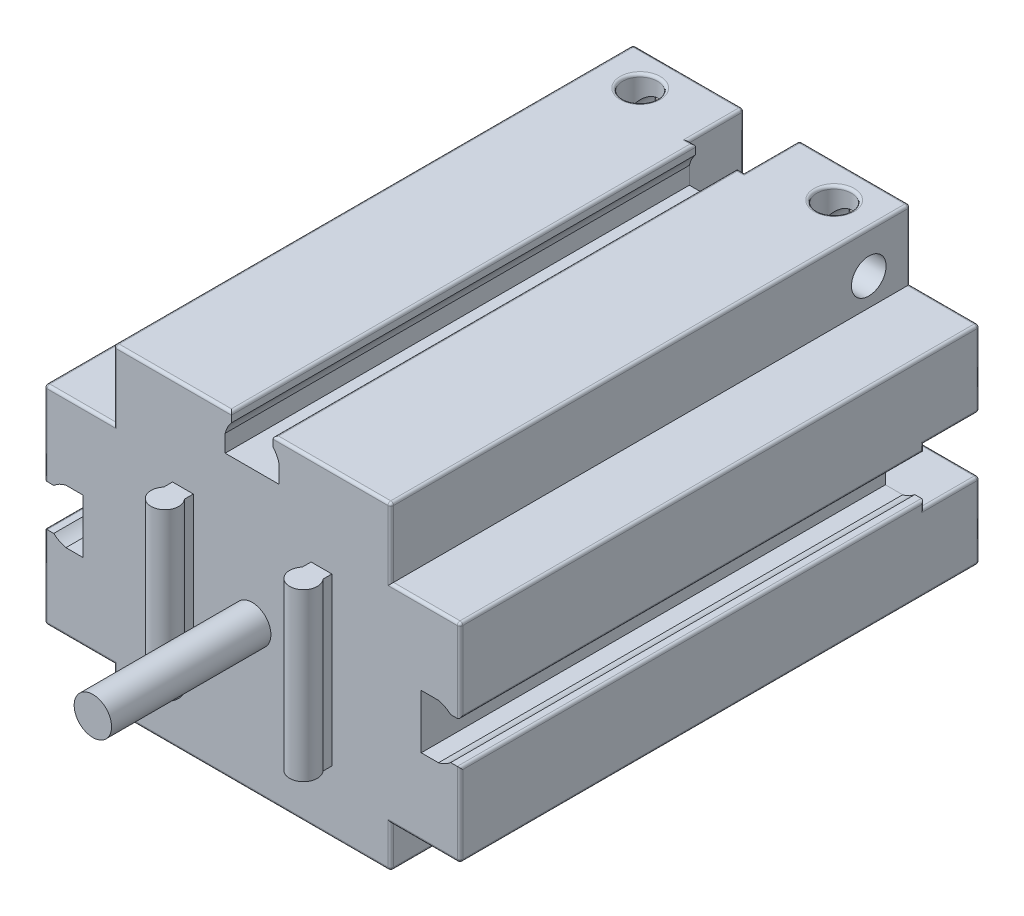
from build123d import *

# Parameters (mm, degrees)
EXTRUDE_1_DEPTH     = 37.5
SKETCH_3_W          = 4
SKETCH_3_H          = 4
CUT_EXTRUDE_1_DEPTH = 4
CUT_EXTRUDE_2_DEPTH = 47.478489648
CUT_EXTRUDE_3_REACH = 53.1
SKETCH_6_R          = 1.35
EXTRUDE_2_DEPTH     = 11.5
EXTRUDE_START       = 4.5
EXTRUDE_3_DEPTH     = 12
SKETCH_8_R          = 1.25
CUT_EXTRUDE_4_DEPTH = 5
SKETCH_9_R          = 1.25
CUT_EXTRUDE_5_DEPTH = 5
SKETCH_10_R         = 1.25
CUT_EXTRUDE_6_DEPTH = 5
CUT_EXTRUDE_START   = -5
SKETCH_11_R         = 1.25
CUT_EXTRUDE_7_DEPTH = 5
FILLET_1_R          = 0.2
FILLET_2_R          = 0.2
FILLET_3_R          = 0.2


with BuildPart() as part:
    # 草图1 → 凸台-拉伸1 (new body)
    with BuildSketch(Plane.XY):
        Polygon((-15, 3), (-10, 3), (-10, 0), (10, 0), (10, 3), (15, 3), (15, 18), (10, 18), (10, 23), (-10, 23), (-10, 18), (-15, 18), align=None)
    extrude(amount=-EXTRUDE_1_DEPTH)

    # 草图3 → 切除-拉伸1 (cut)
    with BuildSketch(Plane(origin=(0, 0, -37.5), x_dir=(-1, 0, 0), z_dir=(0, 0, -1))):
        with Locations((-13, 10.5)):
            Rectangle(SKETCH_3_W, SKETCH_3_H)
        with Locations((13, 10.5)):
            Rectangle(SKETCH_3_W, SKETCH_3_H)
        with Locations((0, 21)):
            Rectangle(SKETCH_3_W, SKETCH_3_H)
    extrude(amount=-CUT_EXTRUDE_1_DEPTH, mode=Mode.SUBTRACT)

    # 草图4 → 切除-拉伸2 (cut, through all)
    with BuildSketch(Plane.XY):
        with BuildLine():
            Line((-1.5, 23), (-1.5, 22.322875656))
            ThreePointArc((-1.5, 22.322875656), (-1.780042303, 21.911838473), (-1.95, 21.444409721))
            Line((-1.95, 21.444409721), (-1.95, 20.2))
            Line((-1.95, 20.2), (1.95, 20.2))
            Line((1.95, 20.2), (1.95, 21.444409721))
            ThreePointArc((1.95, 21.444409721), (1.780042303, 21.911838473), (1.5, 22.322875656))
            Line((1.5, 22.322875656), (1.5, 23))
            Line((1.5, 23), (-1.5, 23))
        make_face()
        with BuildLine():
            Line((-15, 9), (-14.322875656, 9))
            ThreePointArc((-14.322875656, 9), (-13.911838473, 8.719957697), (-13.444409721, 8.55))
            Line((-13.444409721, 8.55), (-12.2, 8.55))
            Line((-12.2, 8.55), (-12.2, 12.45))
            Line((-12.2, 12.45), (-13.444409721, 12.45))
            ThreePointArc((-13.444409721, 12.45), (-13.911838473, 12.280042303), (-14.322875656, 12))
            Line((-14.322875656, 12), (-15, 12))
            Line((-15, 12), (-15, 9))
        make_face()
        with BuildLine():
            Line((12.2, 8.55), (12.2, 12.45))
            Line((12.2, 12.45), (13.444409721, 12.45))
            ThreePointArc((13.444409721, 12.45), (13.911838473, 12.280042303), (14.322875656, 12))
            Line((14.322875656, 12), (15, 12))
            Line((15, 12), (15, 9))
            Line((15, 9), (14.322875656, 9))
            ThreePointArc((14.322875656, 9), (13.911838473, 8.719957697), (13.444409721, 8.55))
            Line((13.444409721, 8.55), (12.2, 8.55))
        make_face()
    extrude(amount=-CUT_EXTRUDE_2_DEPTH, mode=Mode.SUBTRACT)

    # 草图5 → 切除-拉伸3 (cut, up to next)
    with BuildSketch(Plane(origin=(11, 0, 0), x_dir=(0, 0, -1), z_dir=(1, 0, 0)), mode=Mode.PRIVATE) as cut_extrude_3_sk1:
        with BuildLine():
            Line((37.5, 12), (36.822875656, 12))
            ThreePointArc((36.822875656, 12), (36.411838473, 12.280042303), (35.944409721, 12.45))
            Line((35.944409721, 12.45), (34.7, 12.45))
            Line((34.7, 12.45), (34.7, 8.55))
            Line((34.7, 8.55), (35.944409721, 8.55))
            ThreePointArc((35.944409721, 8.55), (36.411838473, 8.719957697), (36.822875656, 9))
            Line((36.822875656, 9), (37.5, 9))
            Line((37.5, 9), (37.5, 12))
        make_face()
    cut_extrude_3_tool1 = extrude(cut_extrude_3_sk1.sketch, amount=-CUT_EXTRUDE_3_REACH, mode=Mode.PRIVATE) & part.part
    add(cut_extrude_3_tool1.solids().sort_by_distance((11, 10.5, -36.020698))[0], mode=Mode.SUBTRACT)

    # 草图6 → 凸台-拉伸2 (add)
    with BuildSketch(Plane.XY):
        with Locations(Location((0, 10.5, 0), (0, 0, 180))):
            Circle(SKETCH_6_R)
    extrude(amount=EXTRUDE_2_DEPTH)

    # 草图7 → 凸台-拉伸3 (add)
    with BuildSketch(Plane(origin=(0, 0, 0), x_dir=(1, 0, 0), z_dir=(0, 1, 0)).offset(EXTRUDE_START)):
        with BuildLine():
            Line((-5.75, -0.638562172), (-5.75, 0))
            Line((-5.75, 0), (-4.25, 0))
            Line((-4.25, 0), (-4.25, -0.638562172))
            ThreePointArc((-4.25, -0.638562172), (-5, -2.3), (-5.75, -0.638562172))
        make_face()
        with BuildLine():
            Line((4.25, 0), (5.75, 0))
            Line((5.75, 0), (5.75, -0.638562172))
            ThreePointArc((5.75, -0.638562172), (5, -2.3), (4.25, -0.638562172))
            Line((4.25, -0.638562172), (4.25, 0))
        make_face()
    extrude(amount=EXTRUDE_3_DEPTH)

    # 草图8 → 切除-拉伸4 (cut)
    with BuildSketch(Plane(origin=(0, 23, 0), x_dir=(-1, 0, 0), z_dir=(0, 1, 0))):
        with Locations(Location((7, -35, 0), (0, 0, 90))):
            Circle(SKETCH_8_R)
        with Locations(Location((-7, -35, 0), (0, 0, 90))):
            Circle(SKETCH_8_R)
    extrude(amount=-CUT_EXTRUDE_4_DEPTH, mode=Mode.SUBTRACT)

    # 草图9 → 切除-拉伸5 (cut)
    with BuildSketch(Plane(origin=(0, 0, -37.5), x_dir=(-1, 0, 0), z_dir=(0, 0, -1))):
        with Locations((-7, 20.5)):
            Circle(SKETCH_9_R)
        with Locations((7, 20.5)):
            Circle(SKETCH_9_R)
    extrude(amount=-CUT_EXTRUDE_5_DEPTH, mode=Mode.SUBTRACT)

    # 草图10 → 切除-拉伸6 (cut)
    with BuildSketch(Plane.ZY.offset(10)):
        with Locations((-34.5, 20)):
            Circle(SKETCH_10_R)
    extrude(amount=-CUT_EXTRUDE_6_DEPTH, mode=Mode.SUBTRACT)

    # 草图11 → 切除-拉伸7 (cut)
    with BuildSketch(Plane(origin=(10, 0, 0), x_dir=(0, 0, -1), z_dir=(1, 0, 0)).offset(CUT_EXTRUDE_START)):
        with Locations(Location((34.5, 20, 0), (0, 0, 180))):
            Circle(SKETCH_11_R)
    extrude(amount=CUT_EXTRUDE_7_DEPTH, mode=Mode.SUBTRACT)

    # 圆角1
    fillet_1_edges = [part.edges().sort_by_distance(p)[0] for p in [
        (-15, 15.25, -37.5),
        (5.75, 23, 0),
        (-15, 12.25, -33.5),
        (-15, 6, 0),
        (15, 6, 0),
        (-15, 9, -16.75),
        (-15, 12, -16.75),
        (0, 0, 0),
        (15, 8.75, -33.5),
        (-15, 15, 0),
        (15, 15, 0),
        (15, 12, -16.75),
        (15, 9, -16.75),
        (0, 0, -37.5),
        (-10, 23, -18.75),
        (10, 23, -18.75),
        (15, 18, -18.75),
        (15, 3, -18.75),
        (10, 0, -18.75),
        (-10, 0, -18.75),
        (-15, 3, -18.75),
        (-15, 18, -18.75),
        (-7, 23, -36.25),
        (7, 23, -36.25),
        (15, 5.75, -37.5),
        (15, 15.25, -37.5),
        (6, 23, -37.5),
        (15, 12.25, -33.5),
        (15, 8.5, -35.5),
        (15, 12.5, -35.5),
        (-15, 5.75, -37.5),
        (-15, 8.75, -33.5),
        (-15, 12.5, -35.5),
        (-15, 8.5, -35.5),
        (-6, 23, -37.5),
        (-1.75, 23, -33.5),
        (2, 23, -35.5),
        (-2, 23, -35.5),
        (1.75, 23, -33.5),
        (-5.75, 23, 0),
        (-1.5, 23, -16.75),
        (1.5, 23, -16.75),
    ]]
    fillet(fillet_1_edges, radius=FILLET_1_R)

    # 圆角2
    # the kernel refuses this fillet: 0.2 mm, written as the material it takes off along each edge
    with BuildSketch(Plane(origin=(14.8, 17.8, -37.3), x_dir=(0, 0, -1), z_dir=(0, 1, 0))) as fillet_2_piece_1_section:
        Polygon((0, 0), (FILLET_2_R, 0), (FILLET_2_R, -FILLET_2_R), (0, -FILLET_2_R), align=None)
    fillet_2_piece_1 = extrude(amount=FILLET_2_R, mode=Mode.PRIVATE)
    fillet_2_piece_1 = fillet_2_piece_1 - Plane(origin=(14.8, 17.8, -37.3), x_dir=(-0.7071067811865475, 0, 0.7071067811865475), z_dir=(0, 1, 0)) * Sphere(FILLET_2_R, mode=Mode.PRIVATE)
    add(fillet_2_piece_1, mode=Mode.SUBTRACT)
    with BuildSketch(Plane(origin=(14.8, 17.8, -0.2), x_dir=(0, 1, 0), z_dir=(0, 0, 1))) as fillet_2_piece_2_section:
        Polygon((0, 0), (FILLET_2_R, 0), (FILLET_2_R, -FILLET_2_R), (0, -FILLET_2_R), align=None)
    fillet_2_piece_2 = extrude(amount=FILLET_2_R, mode=Mode.PRIVATE)
    fillet_2_piece_2 = fillet_2_piece_2 - Plane(origin=(14.8, 17.8, -0.2), x_dir=(-0.7071067811865475, -0.7071067811865475, 0), z_dir=(0, 0, 1)) * Sphere(FILLET_2_R, mode=Mode.PRIVATE)
    add(fillet_2_piece_2, mode=Mode.SUBTRACT)
    with BuildSketch(Plane(origin=(14.8, 3.2, -0.2), x_dir=(0, -1, 0), z_dir=(0, 0, 1))) as fillet_2_piece_3_section:
        Polygon((0, 0), (FILLET_2_R, 0), (FILLET_2_R, FILLET_2_R), (0, FILLET_2_R), align=None)
    fillet_2_piece_3 = extrude(amount=FILLET_2_R, mode=Mode.PRIVATE)
    fillet_2_piece_3 = fillet_2_piece_3 - Plane(origin=(14.8, 3.2, -0.2), x_dir=(-0.7071067811865475, 0.7071067811865475, 0), z_dir=(0, 0, 1)) * Sphere(FILLET_2_R, mode=Mode.PRIVATE)
    add(fillet_2_piece_3, mode=Mode.SUBTRACT)
    with BuildSketch(Plane(origin=(14.8, 3.2, -37.3), x_dir=(0, -1, 0), z_dir=(0, 0, -1))) as fillet_2_piece_4_section:
        Polygon((0, 0), (FILLET_2_R, 0), (FILLET_2_R, -FILLET_2_R), (0, -FILLET_2_R), align=None)
    fillet_2_piece_4 = extrude(amount=FILLET_2_R, mode=Mode.PRIVATE)
    fillet_2_piece_4 = fillet_2_piece_4 - Plane(origin=(14.8, 3.2, -37.3), x_dir=(-0.7071067811865475, 0.7071067811865475, 0), z_dir=(0, 0, -1)) * Sphere(FILLET_2_R, mode=Mode.PRIVATE)
    add(fillet_2_piece_4, mode=Mode.SUBTRACT)
    with BuildSketch(Plane(origin=(-9.8, 0.2, -37.3), x_dir=(0, 0, -1), z_dir=(-1, 0, 0))) as fillet_2_piece_5_section:
        Polygon((0, 0), (FILLET_2_R, 0), (FILLET_2_R, FILLET_2_R), (0, FILLET_2_R), align=None)
    fillet_2_piece_5 = extrude(amount=FILLET_2_R, mode=Mode.PRIVATE)
    fillet_2_piece_5 = fillet_2_piece_5 - Plane(origin=(-9.8, 0.2, -37.3), x_dir=(0, 0.7071067811865475, 0.7071067811865475), z_dir=(-1, 0, 0)) * Sphere(FILLET_2_R, mode=Mode.PRIVATE)
    add(fillet_2_piece_5, mode=Mode.SUBTRACT)
    with BuildSketch(Plane(origin=(-9.8, 0.2, -0.2), x_dir=(-1, 0, 0), z_dir=(0, 0, 1))) as fillet_2_piece_6_section:
        Polygon((0, 0), (FILLET_2_R, 0), (FILLET_2_R, FILLET_2_R), (0, FILLET_2_R), align=None)
    fillet_2_piece_6 = extrude(amount=FILLET_2_R, mode=Mode.PRIVATE)
    fillet_2_piece_6 = fillet_2_piece_6 - Plane(origin=(-9.8, 0.2, -0.2), x_dir=(0.7071067811865475, 0.7071067811865475, 0), z_dir=(0, 0, 1)) * Sphere(FILLET_2_R, mode=Mode.PRIVATE)
    add(fillet_2_piece_6, mode=Mode.SUBTRACT)
    with BuildSketch(Plane(origin=(9.8, 0.2, -37.3), x_dir=(1, 0, 0), z_dir=(0, 0, -1))) as fillet_2_piece_7_section:
        Polygon((0, 0), (FILLET_2_R, 0), (FILLET_2_R, FILLET_2_R), (0, FILLET_2_R), align=None)
    fillet_2_piece_7 = extrude(amount=FILLET_2_R, mode=Mode.PRIVATE)
    fillet_2_piece_7 = fillet_2_piece_7 - Plane(origin=(9.8, 0.2, -37.3), x_dir=(-0.7071067811865477, 0.7071067811865474, 0), z_dir=(0, 0, -1)) * Sphere(FILLET_2_R, mode=Mode.PRIVATE)
    add(fillet_2_piece_7, mode=Mode.SUBTRACT)
    with BuildSketch(Plane(origin=(9.8, 0.2, -0.2), x_dir=(1, 0, 0), z_dir=(0, 0, 1))) as fillet_2_piece_8_section:
        Polygon((0, 0), (FILLET_2_R, 0), (FILLET_2_R, -FILLET_2_R), (0, -FILLET_2_R), align=None)
    fillet_2_piece_8 = extrude(amount=FILLET_2_R, mode=Mode.PRIVATE)
    fillet_2_piece_8 = fillet_2_piece_8 - Plane(origin=(9.8, 0.2, -0.2), x_dir=(-0.7071067811865477, 0.7071067811865474, 0), z_dir=(0, 0, 1)) * Sphere(FILLET_2_R, mode=Mode.PRIVATE)
    add(fillet_2_piece_8, mode=Mode.SUBTRACT)
    with BuildSketch(Plane(origin=(-14.8, 3.2, -37.3), x_dir=(0, 0, -1), z_dir=(0, -1, 0))) as fillet_2_piece_9_section:
        Polygon((0, 0), (FILLET_2_R, 0), (FILLET_2_R, -FILLET_2_R), (0, -FILLET_2_R), align=None)
    fillet_2_piece_9 = extrude(amount=FILLET_2_R, mode=Mode.PRIVATE)
    fillet_2_piece_9 = fillet_2_piece_9 - Plane(origin=(-14.8, 3.2, -37.3), x_dir=(0.7071067811865475, 0, 0.7071067811865475), z_dir=(0, -1, 0)) * Sphere(FILLET_2_R, mode=Mode.PRIVATE)
    add(fillet_2_piece_9, mode=Mode.SUBTRACT)
    with BuildSketch(Plane(origin=(-14.8, 3.2, -0.2), x_dir=(0, 0, 1), z_dir=(0, -1, 0))) as fillet_2_piece_10_section:
        Polygon((0, 0), (FILLET_2_R, 0), (FILLET_2_R, FILLET_2_R), (0, FILLET_2_R), align=None)
    fillet_2_piece_10 = extrude(amount=FILLET_2_R, mode=Mode.PRIVATE)
    fillet_2_piece_10 = fillet_2_piece_10 - Plane(origin=(-14.8, 3.2, -0.2), x_dir=(0.7071067811865475, 0, -0.7071067811865475), z_dir=(0, -1, 0)) * Sphere(FILLET_2_R, mode=Mode.PRIVATE)
    add(fillet_2_piece_10, mode=Mode.SUBTRACT)
    with BuildSketch(Plane(origin=(-14.8, 17.8, -0.2), x_dir=(0, 1, 0), z_dir=(0, 0, 1))) as fillet_2_piece_11_section:
        Polygon((0, 0), (FILLET_2_R, 0), (FILLET_2_R, FILLET_2_R), (0, FILLET_2_R), align=None)
    fillet_2_piece_11 = extrude(amount=FILLET_2_R, mode=Mode.PRIVATE)
    fillet_2_piece_11 = fillet_2_piece_11 - Plane(origin=(-14.8, 17.8, -0.2), x_dir=(0.7071067811865475, -0.7071067811865475, 0), z_dir=(0, 0, 1)) * Sphere(FILLET_2_R, mode=Mode.PRIVATE)
    add(fillet_2_piece_11, mode=Mode.SUBTRACT)
    with BuildSketch(Plane(origin=(-14.8, 17.8, -37.3), x_dir=(0, 0, -1), z_dir=(0, 1, 0))) as fillet_2_piece_12_section:
        Polygon((0, 0), (FILLET_2_R, 0), (FILLET_2_R, FILLET_2_R), (0, FILLET_2_R), align=None)
    fillet_2_piece_12 = extrude(amount=FILLET_2_R, mode=Mode.PRIVATE)
    fillet_2_piece_12 = fillet_2_piece_12 - Plane(origin=(-14.8, 17.8, -37.3), x_dir=(0.7071067811865475, 0, 0.7071067811865475), z_dir=(0, 1, 0)) * Sphere(FILLET_2_R, mode=Mode.PRIVATE)
    add(fillet_2_piece_12, mode=Mode.SUBTRACT)
    with BuildSketch(Plane(origin=(-9.8, 22.8, -37.3), x_dir=(0, 0, -1), z_dir=(-1, 0, 0))) as fillet_2_piece_13_section:
        Polygon((0, 0), (FILLET_2_R, 0), (FILLET_2_R, -FILLET_2_R), (0, -FILLET_2_R), align=None)
    fillet_2_piece_13 = extrude(amount=FILLET_2_R, mode=Mode.PRIVATE)
    fillet_2_piece_13 = fillet_2_piece_13 - Plane(origin=(-9.8, 22.8, -37.3), x_dir=(0, -0.7071067811865475, 0.7071067811865475), z_dir=(-1, 0, 0)) * Sphere(FILLET_2_R, mode=Mode.PRIVATE)
    add(fillet_2_piece_13, mode=Mode.SUBTRACT)
    with BuildSketch(Plane(origin=(-9.8, 22.8, -0.2), x_dir=(-1, 0, 0), z_dir=(0, 0, 1))) as fillet_2_piece_14_section:
        Polygon((0, 0), (FILLET_2_R, 0), (FILLET_2_R, -FILLET_2_R), (0, -FILLET_2_R), align=None)
    fillet_2_piece_14 = extrude(amount=FILLET_2_R, mode=Mode.PRIVATE)
    fillet_2_piece_14 = fillet_2_piece_14 - Plane(origin=(-9.8, 22.8, -0.2), x_dir=(0.7071067811865475, -0.7071067811865475, 0), z_dir=(0, 0, 1)) * Sphere(FILLET_2_R, mode=Mode.PRIVATE)
    add(fillet_2_piece_14, mode=Mode.SUBTRACT)
    with BuildSketch(Plane(origin=(9.8, 22.8, -0.2), x_dir=(1, 0, 0), z_dir=(0, 0, 1))) as fillet_2_piece_15_section:
        Polygon((0, 0), (FILLET_2_R, 0), (FILLET_2_R, FILLET_2_R), (0, FILLET_2_R), align=None)
    fillet_2_piece_15 = extrude(amount=FILLET_2_R, mode=Mode.PRIVATE)
    fillet_2_piece_15 = fillet_2_piece_15 - Plane(origin=(9.8, 22.8, -0.2), x_dir=(-0.7071067811865476, -0.7071067811865474, 0), z_dir=(0, 0, 1)) * Sphere(FILLET_2_R, mode=Mode.PRIVATE)
    add(fillet_2_piece_15, mode=Mode.SUBTRACT)
    with BuildSketch(Plane(origin=(9.8, 22.8, -37.3), x_dir=(0, 0, -1), z_dir=(1, 0, 0))) as fillet_2_piece_16_section:
        Polygon((0, 0), (FILLET_2_R, 0), (FILLET_2_R, FILLET_2_R), (0, FILLET_2_R), align=None)
    fillet_2_piece_16 = extrude(amount=FILLET_2_R, mode=Mode.PRIVATE)
    fillet_2_piece_16 = fillet_2_piece_16 - Plane(origin=(9.8, 22.8, -37.3), x_dir=(0, -0.7071067811865475, 0.7071067811865475), z_dir=(1, 0, 0)) * Sphere(FILLET_2_R, mode=Mode.PRIVATE)
    add(fillet_2_piece_16, mode=Mode.SUBTRACT)
    with BuildSketch(Plane(origin=(10, 18, 0), x_dir=(-1, 0, 0), z_dir=(0, 1, 0)), Plane(origin=(10, 3, 0), x_dir=(0, 1, 0), z_dir=(1, 0, 0)), Plane(origin=(-10, 18, 0), x_dir=(0, -1, 0), z_dir=(-1, 0, 0)), Plane(origin=(14.8, 18, 0), x_dir=(0, -1, 0), z_dir=(-1, 0, 0)), Plane(origin=(-10, 22.8, 0), x_dir=(1, 0, 0), z_dir=(0, -1, 0)), Plane(origin=(14.8, 18, -37.5), x_dir=(0, 0, 1), z_dir=(-1, 0, 0)), Plane(origin=(-10, 22.8, -37.5), x_dir=(0, 0, 1), z_dir=(0, -1, 0)), Plane(origin=(-14.8, 3, -37.5), x_dir=(0, 0, 1), z_dir=(1, 0, 0)), Plane(origin=(10, 18, -37.5), x_dir=(0, 0, 1), z_dir=(0, 1, 0)), Plane(origin=(-10, 18, -37.5), x_dir=(0, 0, 1), z_dir=(-1, 0, 0))) as fillet_2_piece_17:
        with BuildLine():
            CenterArc((FILLET_2_R, -FILLET_2_R), FILLET_2_R, 90, 90)
            Line((0, -FILLET_2_R), (0, 0))
            Line((0, 0), (FILLET_2_R, 0))
        make_face()
    extrude(amount=4.8, mode=Mode.SUBTRACT)
    with BuildSketch(Plane(origin=(-10, 3, 0), x_dir=(1, 0, 0), z_dir=(0, -1, 0)), Plane(origin=(-10, 3, -37.5), x_dir=(0, 0, 1), z_dir=(0, -1, 0)), Plane(origin=(10, 0.2, 0), x_dir=(-1, 0, 0), z_dir=(0, 1, 0))) as fillet_2_piece_18:
        with BuildLine():
            CenterArc((FILLET_2_R, -FILLET_2_R), FILLET_2_R, 90, 90)
            Line((0, -FILLET_2_R), (0, 0))
            Line((0, 0), (FILLET_2_R, 0))
        make_face()
    extrude(amount=2.8, mode=Mode.SUBTRACT)
    with BuildSketch(Plane(origin=(10, 3, -37.5), x_dir=(0, 1, 0), z_dir=(1, 0, 0)), Plane(origin=(-14.8, 3, 0), x_dir=(0, 0, -1), z_dir=(1, 0, 0))) as fillet_2_piece_19:
        with BuildLine():
            CenterArc((FILLET_2_R, FILLET_2_R), FILLET_2_R, 180, 90)
            Line((0, FILLET_2_R), (0, 0))
            Line((0, 0), (FILLET_2_R, 0))
        make_face()
    extrude(amount=4.8, mode=Mode.SUBTRACT)
    with BuildSketch(Plane(origin=(10, 0.2, -37.5), x_dir=(-1, 0, 0), z_dir=(0, 1, 0))) as fillet_2_piece_20:
        with BuildLine():
            CenterArc((FILLET_2_R, FILLET_2_R), FILLET_2_R, 180, 90)
            Line((0, FILLET_2_R), (0, 0))
            Line((0, 0), (FILLET_2_R, 0))
        make_face()
    extrude(amount=2.8, mode=Mode.SUBTRACT)
    with BuildSketch(Plane(origin=(14.8, 18, 0), x_dir=(0, -1, 0), z_dir=(-1, 0, 0))) as fillet_2_piece_21a_section:
        with BuildLine():
            CenterArc((FILLET_2_R, -FILLET_2_R), FILLET_2_R, 90, 90)
            Line((0, -FILLET_2_R), (0, 0))
            Line((0, 0), (FILLET_2_R, 0))
        make_face()
    fillet_2_piece_21a = extrude(amount=5.3, mode=Mode.PRIVATE)
    fillet_2_piece_21a = split(fillet_2_piece_21a, bisect_by=Plane(origin=(10, 17.954720977, -0.045279023), z_dir=(-1, 0, 0)), keep=Keep.TOP, mode=Mode.PRIVATE)
    with BuildSketch(Plane(origin=(10, 17.5, 0), x_dir=(-1, 0, 0), z_dir=(0, 1, 0))) as fillet_2_piece_21b_section:
        with BuildLine():
            CenterArc((FILLET_2_R, -FILLET_2_R), FILLET_2_R, 90, 90)
            Line((0, -FILLET_2_R), (0, 0))
            Line((0, 0), (FILLET_2_R, 0))
        make_face()
    fillet_2_piece_21b = extrude(amount=5.3, mode=Mode.PRIVATE)
    fillet_2_piece_21b = split(fillet_2_piece_21b, bisect_by=Plane(origin=(9.954720977, 18, -0.045279023), z_dir=(0, -1, 0)), keep=Keep.TOP, mode=Mode.PRIVATE)
    fillet_2_piece_21 = fillet_2_piece_21a & fillet_2_piece_21b
    add(fillet_2_piece_21, mode=Mode.SUBTRACT)
    with BuildSketch(Plane(origin=(10, 0.2, 0), x_dir=(-1, 0, 0), z_dir=(0, 1, 0))) as fillet_2_piece_22a_section:
        with BuildLine():
            CenterArc((FILLET_2_R, -FILLET_2_R), FILLET_2_R, 90, 90)
            Line((0, -FILLET_2_R), (0, 0))
            Line((0, 0), (FILLET_2_R, 0))
        make_face()
    fillet_2_piece_22a = extrude(amount=3.3, mode=Mode.PRIVATE)
    fillet_2_piece_22a = split(fillet_2_piece_22a, bisect_by=Plane(origin=(9.954720977, 3, -0.045279023), z_dir=(0, 1, 0)), keep=Keep.TOP, mode=Mode.PRIVATE)
    with BuildSketch(Plane(origin=(9.5, 3, 0), x_dir=(0, 1, 0), z_dir=(1, 0, 0))) as fillet_2_piece_22b_section:
        with BuildLine():
            CenterArc((FILLET_2_R, -FILLET_2_R), FILLET_2_R, 90, 90)
            Line((0, -FILLET_2_R), (0, 0))
            Line((0, 0), (FILLET_2_R, 0))
        make_face()
    fillet_2_piece_22b = extrude(amount=5.3, mode=Mode.PRIVATE)
    fillet_2_piece_22b = split(fillet_2_piece_22b, bisect_by=Plane(origin=(10, 3.045279023, -0.045279023), z_dir=(-1, 0, 0)), keep=Keep.TOP, mode=Mode.PRIVATE)
    fillet_2_piece_22 = fillet_2_piece_22a & fillet_2_piece_22b
    add(fillet_2_piece_22, mode=Mode.SUBTRACT)
    with BuildSketch(Plane(origin=(-14.8, 3, 0), x_dir=(0, 0, -1), z_dir=(1, 0, 0))) as fillet_2_piece_23a_section:
        with BuildLine():
            CenterArc((FILLET_2_R, FILLET_2_R), FILLET_2_R, 180, 90)
            Line((0, FILLET_2_R), (0, 0))
            Line((0, 0), (FILLET_2_R, 0))
        make_face()
    fillet_2_piece_23a = extrude(amount=5.3, mode=Mode.PRIVATE)
    fillet_2_piece_23a = split(fillet_2_piece_23a, bisect_by=Plane(origin=(-10, 3.045279023, -0.045279023), z_dir=(1, 0, 0)), keep=Keep.TOP, mode=Mode.PRIVATE)
    with BuildSketch(Plane(origin=(-10, 3.5, 0), x_dir=(1, 0, 0), z_dir=(0, -1, 0))) as fillet_2_piece_23b_section:
        with BuildLine():
            CenterArc((FILLET_2_R, -FILLET_2_R), FILLET_2_R, 90, 90)
            Line((0, -FILLET_2_R), (0, 0))
            Line((0, 0), (FILLET_2_R, 0))
        make_face()
    fillet_2_piece_23b = extrude(amount=3.3, mode=Mode.PRIVATE)
    fillet_2_piece_23b = split(fillet_2_piece_23b, bisect_by=Plane(origin=(-9.954720977, 3, -0.045279023), z_dir=(0, 1, 0)), keep=Keep.TOP, mode=Mode.PRIVATE)
    fillet_2_piece_23 = fillet_2_piece_23a & fillet_2_piece_23b
    add(fillet_2_piece_23, mode=Mode.SUBTRACT)
    with BuildSketch(Plane(origin=(-9.5, 18, 0), x_dir=(0, -1, 0), z_dir=(-1, 0, 0))) as fillet_2_piece_24a_section:
        with BuildLine():
            CenterArc((FILLET_2_R, -FILLET_2_R), FILLET_2_R, 90, 90)
            Line((0, -FILLET_2_R), (0, 0))
            Line((0, 0), (FILLET_2_R, 0))
        make_face()
    fillet_2_piece_24a = extrude(amount=5.3, mode=Mode.PRIVATE)
    fillet_2_piece_24a = split(fillet_2_piece_24a, bisect_by=Plane(origin=(-10, 17.954720977, -0.045279023), z_dir=(1, 0, 0)), keep=Keep.TOP, mode=Mode.PRIVATE)
    with BuildSketch(Plane(origin=(-10, 22.8, 0), x_dir=(1, 0, 0), z_dir=(0, -1, 0))) as fillet_2_piece_24b_section:
        with BuildLine():
            CenterArc((FILLET_2_R, -FILLET_2_R), FILLET_2_R, 90, 90)
            Line((0, -FILLET_2_R), (0, 0))
            Line((0, 0), (FILLET_2_R, 0))
        make_face()
    fillet_2_piece_24b = extrude(amount=5.3, mode=Mode.PRIVATE)
    fillet_2_piece_24b = split(fillet_2_piece_24b, bisect_by=Plane(origin=(-9.954720977, 18, -0.045279023), z_dir=(0, -1, 0)), keep=Keep.TOP, mode=Mode.PRIVATE)
    fillet_2_piece_24 = fillet_2_piece_24a & fillet_2_piece_24b
    add(fillet_2_piece_24, mode=Mode.SUBTRACT)
    with BuildSketch(Plane(origin=(-14.8, 3, -37.5), x_dir=(0, 0, 1), z_dir=(1, 0, 0))) as fillet_2_piece_25a_section:
        with BuildLine():
            CenterArc((FILLET_2_R, -FILLET_2_R), FILLET_2_R, 90, 90)
            Line((0, -FILLET_2_R), (0, 0))
            Line((0, 0), (FILLET_2_R, 0))
        make_face()
    fillet_2_piece_25a = extrude(amount=5.3, mode=Mode.PRIVATE)
    fillet_2_piece_25a = split(fillet_2_piece_25a, bisect_by=Plane(origin=(-10, 3.045279023, -37.454720977), z_dir=(1, 0, 0)), keep=Keep.TOP, mode=Mode.PRIVATE)
    with BuildSketch(Plane(origin=(-10, 3.5, -37.5), x_dir=(0, 0, 1), z_dir=(0, -1, 0))) as fillet_2_piece_25b_section:
        with BuildLine():
            CenterArc((FILLET_2_R, -FILLET_2_R), FILLET_2_R, 90, 90)
            Line((0, -FILLET_2_R), (0, 0))
            Line((0, 0), (FILLET_2_R, 0))
        make_face()
    fillet_2_piece_25b = extrude(amount=3.3, mode=Mode.PRIVATE)
    fillet_2_piece_25b = split(fillet_2_piece_25b, bisect_by=Plane(origin=(-9.954720977, 3, -37.454720977), z_dir=(0, 1, 0)), keep=Keep.TOP, mode=Mode.PRIVATE)
    fillet_2_piece_25 = fillet_2_piece_25a & fillet_2_piece_25b
    add(fillet_2_piece_25, mode=Mode.SUBTRACT)
    with BuildSketch(Plane(origin=(10, 0.2, -37.5), x_dir=(-1, 0, 0), z_dir=(0, 1, 0))) as fillet_2_piece_26a_section:
        with BuildLine():
            CenterArc((FILLET_2_R, FILLET_2_R), FILLET_2_R, 180, 90)
            Line((0, FILLET_2_R), (0, 0))
            Line((0, 0), (FILLET_2_R, 0))
        make_face()
    fillet_2_piece_26a = extrude(amount=3.3, mode=Mode.PRIVATE)
    fillet_2_piece_26a = split(fillet_2_piece_26a, bisect_by=Plane(origin=(9.954720977, 3, -37.454720977), z_dir=(0, 1, 0)), keep=Keep.TOP, mode=Mode.PRIVATE)
    with BuildSketch(Plane(origin=(9.5, 3, -37.5), x_dir=(0, 1, 0), z_dir=(1, 0, 0))) as fillet_2_piece_26b_section:
        with BuildLine():
            CenterArc((FILLET_2_R, FILLET_2_R), FILLET_2_R, 180, 90)
            Line((0, FILLET_2_R), (0, 0))
            Line((0, 0), (FILLET_2_R, 0))
        make_face()
    fillet_2_piece_26b = extrude(amount=5.3, mode=Mode.PRIVATE)
    fillet_2_piece_26b = split(fillet_2_piece_26b, bisect_by=Plane(origin=(10, 3.045279023, -37.454720977), z_dir=(-1, 0, 0)), keep=Keep.TOP, mode=Mode.PRIVATE)
    fillet_2_piece_26 = fillet_2_piece_26a & fillet_2_piece_26b
    add(fillet_2_piece_26, mode=Mode.SUBTRACT)
    with BuildSketch(Plane(origin=(14.8, 18, -37.5), x_dir=(0, 0, 1), z_dir=(-1, 0, 0))) as fillet_2_piece_27a_section:
        with BuildLine():
            CenterArc((FILLET_2_R, -FILLET_2_R), FILLET_2_R, 90, 90)
            Line((0, -FILLET_2_R), (0, 0))
            Line((0, 0), (FILLET_2_R, 0))
        make_face()
    fillet_2_piece_27a = extrude(amount=5.3, mode=Mode.PRIVATE)
    fillet_2_piece_27a = split(fillet_2_piece_27a, bisect_by=Plane(origin=(10, 17.954720977, -37.454720977), z_dir=(-1, 0, 0)), keep=Keep.TOP, mode=Mode.PRIVATE)
    with BuildSketch(Plane(origin=(10, 17.5, -37.5), x_dir=(0, 0, 1), z_dir=(0, 1, 0))) as fillet_2_piece_27b_section:
        with BuildLine():
            CenterArc((FILLET_2_R, -FILLET_2_R), FILLET_2_R, 90, 90)
            Line((0, -FILLET_2_R), (0, 0))
            Line((0, 0), (FILLET_2_R, 0))
        make_face()
    fillet_2_piece_27b = extrude(amount=5.3, mode=Mode.PRIVATE)
    fillet_2_piece_27b = split(fillet_2_piece_27b, bisect_by=Plane(origin=(9.954720977, 18, -37.454720977), z_dir=(0, -1, 0)), keep=Keep.TOP, mode=Mode.PRIVATE)
    fillet_2_piece_27 = fillet_2_piece_27a & fillet_2_piece_27b
    add(fillet_2_piece_27, mode=Mode.SUBTRACT)
    with BuildSketch(Plane(origin=(-9.5, 18, -37.5), x_dir=(0, 0, 1), z_dir=(-1, 0, 0))) as fillet_2_piece_28a_section:
        with BuildLine():
            CenterArc((FILLET_2_R, -FILLET_2_R), FILLET_2_R, 90, 90)
            Line((0, -FILLET_2_R), (0, 0))
            Line((0, 0), (FILLET_2_R, 0))
        make_face()
    fillet_2_piece_28a = extrude(amount=5.3, mode=Mode.PRIVATE)
    fillet_2_piece_28a = split(fillet_2_piece_28a, bisect_by=Plane(origin=(-10, 17.954720977, -37.454720977), z_dir=(1, 0, 0)), keep=Keep.TOP, mode=Mode.PRIVATE)
    with BuildSketch(Plane(origin=(-10, 22.8, -37.5), x_dir=(0, 0, 1), z_dir=(0, -1, 0))) as fillet_2_piece_28b_section:
        with BuildLine():
            CenterArc((FILLET_2_R, -FILLET_2_R), FILLET_2_R, 90, 90)
            Line((0, -FILLET_2_R), (0, 0))
            Line((0, 0), (FILLET_2_R, 0))
        make_face()
    fillet_2_piece_28b = extrude(amount=5.3, mode=Mode.PRIVATE)
    fillet_2_piece_28b = split(fillet_2_piece_28b, bisect_by=Plane(origin=(-9.954720977, 18, -37.454720977), z_dir=(0, -1, 0)), keep=Keep.TOP, mode=Mode.PRIVATE)
    fillet_2_piece_28 = fillet_2_piece_28a & fillet_2_piece_28b
    add(fillet_2_piece_28, mode=Mode.SUBTRACT)

    # 圆角3
    # the kernel refuses this fillet: 0.2 mm, written as the material it takes off along each edge
    with BuildSketch(Plane(origin=(14.8, 12.7, -37.3), x_dir=(0, -1, 0), z_dir=(0, 0, -1))) as fillet_3_piece_1_section:
        Polygon((0, 0), (FILLET_3_R, 0), (FILLET_3_R, -FILLET_3_R), (0, -FILLET_3_R), align=None)
    fillet_3_piece_1 = extrude(amount=FILLET_3_R, mode=Mode.PRIVATE)
    fillet_3_piece_1 = fillet_3_piece_1 - Plane(origin=(14.8, 12.7, -37.3), x_dir=(-0.7071067811865475, 0.7071067811865475, 0), z_dir=(0, 0, -1)) * Sphere(FILLET_3_R, mode=Mode.PRIVATE)
    add(fillet_3_piece_1, mode=Mode.SUBTRACT)
    with BuildSketch(Plane(origin=(14.8, 8.3, -37.3), x_dir=(0, 1, 0), z_dir=(0, 0, -1))) as fillet_3_piece_2_section:
        Polygon((0, 0), (FILLET_3_R, 0), (FILLET_3_R, FILLET_3_R), (0, FILLET_3_R), align=None)
    fillet_3_piece_2 = extrude(amount=FILLET_3_R, mode=Mode.PRIVATE)
    fillet_3_piece_2 = fillet_3_piece_2 - Plane(origin=(14.8, 8.3, -37.3), x_dir=(-0.7071067811865475, -0.7071067811865475, 0), z_dir=(0, 0, -1)) * Sphere(FILLET_3_R, mode=Mode.PRIVATE)
    add(fillet_3_piece_2, mode=Mode.SUBTRACT)
    with BuildSketch(Plane(origin=(-14.8, 8.3, -37.3), x_dir=(0, 0, -1), z_dir=(0, 1, 0))) as fillet_3_piece_3_section:
        Polygon((0, 0), (FILLET_3_R, 0), (FILLET_3_R, FILLET_3_R), (0, FILLET_3_R), align=None)
    fillet_3_piece_3 = extrude(amount=FILLET_3_R, mode=Mode.PRIVATE)
    fillet_3_piece_3 = fillet_3_piece_3 - Plane(origin=(-14.8, 8.3, -37.3), x_dir=(0.7071067811865475, 0, 0.7071067811865475), z_dir=(0, 1, 0)) * Sphere(FILLET_3_R, mode=Mode.PRIVATE)
    add(fillet_3_piece_3, mode=Mode.SUBTRACT)
    with BuildSketch(Plane(origin=(-14.8, 12.7, -37.3), x_dir=(0, -1, 0), z_dir=(0, 0, -1))) as fillet_3_piece_4_section:
        Polygon((0, 0), (FILLET_3_R, 0), (FILLET_3_R, FILLET_3_R), (0, FILLET_3_R), align=None)
    fillet_3_piece_4 = extrude(amount=FILLET_3_R, mode=Mode.PRIVATE)
    fillet_3_piece_4 = fillet_3_piece_4 - Plane(origin=(-14.8, 12.7, -37.3), x_dir=(0.7071067811865475, 0.7071067811865475, 0), z_dir=(0, 0, -1)) * Sphere(FILLET_3_R, mode=Mode.PRIVATE)
    add(fillet_3_piece_4, mode=Mode.SUBTRACT)
    with BuildSketch(Plane(origin=(-2.2, 22.8, -37.3), x_dir=(1, 0, 0), z_dir=(0, 0, -1))) as fillet_3_piece_5_section:
        Polygon((0, 0), (FILLET_3_R, 0), (FILLET_3_R, -FILLET_3_R), (0, -FILLET_3_R), align=None)
    fillet_3_piece_5 = extrude(amount=FILLET_3_R, mode=Mode.PRIVATE)
    fillet_3_piece_5 = fillet_3_piece_5 - Plane(origin=(-2.2, 22.8, -37.3), x_dir=(-0.7071067811865476, -0.7071067811865475, 0), z_dir=(0, 0, -1)) * Sphere(FILLET_3_R, mode=Mode.PRIVATE)
    add(fillet_3_piece_5, mode=Mode.SUBTRACT)
    with BuildSketch(Plane(origin=(2.2, 22.8, -37.3), x_dir=(-1, 0, 0), z_dir=(0, 0, -1))) as fillet_3_piece_6_section:
        Polygon((0, 0), (FILLET_3_R, 0), (FILLET_3_R, FILLET_3_R), (0, FILLET_3_R), align=None)
    fillet_3_piece_6 = extrude(amount=FILLET_3_R, mode=Mode.PRIVATE)
    fillet_3_piece_6 = fillet_3_piece_6 - Plane(origin=(2.2, 22.8, -37.3), x_dir=(0.7071067811865475, -0.7071067811865475, 0), z_dir=(0, 0, -1)) * Sphere(FILLET_3_R, mode=Mode.PRIVATE)
    add(fillet_3_piece_6, mode=Mode.SUBTRACT)
    with BuildSketch(Plane(origin=(-11, 9.5, -37.5), x_dir=(1, 0, 0), z_dir=(0, -1, 0)), Plane(origin=(-11, 12.5, -37.5), x_dir=(1, 0, 0), z_dir=(0, -1, 0))) as fillet_3_piece_7:
        with BuildLine():
            CenterArc((FILLET_3_R, FILLET_3_R), FILLET_3_R, 180, 90)
            Line((0, FILLET_3_R), (0, 0))
            Line((0, 0), (FILLET_3_R, 0))
        make_face()
    extrude(amount=1, mode=Mode.SUBTRACT)
    with BuildSketch(Plane(origin=(11, 12.5, -37.5), x_dir=(-1, 0, 0), z_dir=(0, -1, 0)), Plane(origin=(11, 9.5, -37.5), x_dir=(-1, 0, 0), z_dir=(0, -1, 0))) as fillet_3_piece_8:
        with BuildLine():
            CenterArc((FILLET_3_R, -FILLET_3_R), FILLET_3_R, 90, 90)
            Line((0, -FILLET_3_R), (0, 0))
            Line((0, 0), (FILLET_3_R, 0))
        make_face()
    extrude(amount=1, mode=Mode.SUBTRACT)
    with BuildSketch(Plane(origin=(11.5, 12, -37.5), x_dir=(0, 0, 1), z_dir=(-1, 0, 0)), Plane(origin=(11.5, 9, -37.5), x_dir=(0, -1, 0), z_dir=(-1, 0, 0))) as fillet_3_piece_9:
        with BuildLine():
            CenterArc((FILLET_3_R, FILLET_3_R), FILLET_3_R, 180, 90)
            Line((0, FILLET_3_R), (0, 0))
            Line((0, 0), (FILLET_3_R, 0))
        make_face()
    extrude(amount=23, mode=Mode.SUBTRACT)
    with BuildSketch(Plane(origin=(7, 20.5, -37.5), x_dir=(-1, 0, 0), z_dir=(0, -1, 0))) as fillet_3_piece_10:
        with BuildLine():
            CenterArc((1.25 + FILLET_3_R, -FILLET_3_R), FILLET_3_R, 90, 90)
            Line((1.25, -FILLET_3_R), (1.25, 0))
            Line((1.25, 0), (1.25 + FILLET_3_R, 0))
        make_face()
    revolve(axis=Axis((7, 20.5, -37.5), (0, 0, -1)), mode=Mode.SUBTRACT)
    with BuildSketch(Plane(origin=(-7, 20.5, -37.5), x_dir=(-1, 0, 0), z_dir=(0, -1, 0))) as fillet_3_piece_11:
        with BuildLine():
            CenterArc((1.25 + FILLET_3_R, -FILLET_3_R), FILLET_3_R, 90, 90)
            Line((1.25, -FILLET_3_R), (1.25, 0))
            Line((1.25, 0), (1.25 + FILLET_3_R, 0))
        make_face()
    revolve(axis=Axis((-7, 20.5, -37.5), (0, 0, -1)), mode=Mode.SUBTRACT)
    with BuildSketch(Plane(origin=(-14.8, 12.5, -37.5), x_dir=(0, 1, 0), z_dir=(1, 0, 0))) as fillet_3_piece_12:
        with BuildLine():
            CenterArc((FILLET_3_R, FILLET_3_R), FILLET_3_R, 180, 90)
            Line((0, FILLET_3_R), (0, 0))
            Line((0, 0), (FILLET_3_R, 0))
        make_face()
    extrude(amount=3.8, mode=Mode.SUBTRACT)
    with BuildSketch(Plane(origin=(2, 19, -37.5), x_dir=(1, 0, 0), z_dir=(0, 1, 0)), Plane(origin=(11, 8.5, -37.5), x_dir=(0, -1, 0), z_dir=(1, 0, 0)), Plane(origin=(14.8, 12.5, -37.5), x_dir=(0, 1, 0), z_dir=(-1, 0, 0)), Plane(origin=(-11, 8.5, -37.5), x_dir=(0, 0, 1), z_dir=(-1, 0, 0)), Plane(origin=(-2, 22.8, -37.5), x_dir=(-1, 0, 0), z_dir=(0, -1, 0))) as fillet_3_piece_13:
        with BuildLine():
            CenterArc((FILLET_3_R, -FILLET_3_R), FILLET_3_R, 90, 90)
            Line((0, -FILLET_3_R), (0, 0))
            Line((0, 0), (FILLET_3_R, 0))
        make_face()
    extrude(amount=3.8, mode=Mode.SUBTRACT)
    with BuildSketch(Plane(origin=(-2, 19, -37.5), x_dir=(0, -1, 0), z_dir=(1, 0, 0))) as fillet_3_piece_14:
        with BuildLine():
            CenterArc((FILLET_3_R, -FILLET_3_R), FILLET_3_R, 90, 90)
            Line((0, -FILLET_3_R), (0, 0))
            Line((0, 0), (FILLET_3_R, 0))
        make_face()
    extrude(amount=4, mode=Mode.SUBTRACT)
    with BuildSketch(Plane(origin=(-10.5, 8.5, -37.5), x_dir=(0, 0, 1), z_dir=(-1, 0, 0))) as fillet_3_piece_15a_section:
        with BuildLine():
            CenterArc((FILLET_3_R, -FILLET_3_R), FILLET_3_R, 90, 90)
            Line((0, -FILLET_3_R), (0, 0))
            Line((0, 0), (FILLET_3_R, 0))
        make_face()
    fillet_3_piece_15a = extrude(amount=4.3, mode=Mode.PRIVATE)
    fillet_3_piece_15a = split(fillet_3_piece_15a, bisect_by=Plane(origin=(-11, 8.454720977, -37.454720977), z_dir=(1, 0, 0)), keep=Keep.TOP, mode=Mode.PRIVATE)
    with BuildSketch(Plane(origin=(-11, 9.5, -37.5), x_dir=(1, 0, 0), z_dir=(0, -1, 0))) as fillet_3_piece_15b_section:
        with BuildLine():
            CenterArc((FILLET_3_R, FILLET_3_R), FILLET_3_R, 180, 90)
            Line((0, FILLET_3_R), (0, 0))
            Line((0, 0), (FILLET_3_R, 0))
        make_face()
    fillet_3_piece_15b = extrude(amount=1.5, mode=Mode.PRIVATE)
    fillet_3_piece_15b = split(fillet_3_piece_15b, bisect_by=Plane(origin=(-10.954720977, 8.5, -37.454720977), z_dir=(0, -1, 0)), keep=Keep.TOP, mode=Mode.PRIVATE)
    fillet_3_piece_15 = fillet_3_piece_15a & fillet_3_piece_15b
    add(fillet_3_piece_15, mode=Mode.SUBTRACT)
    with BuildSketch(Plane(origin=(11, 13, -37.5), x_dir=(-1, 0, 0), z_dir=(0, -1, 0))) as fillet_3_piece_16a_section:
        with BuildLine():
            CenterArc((FILLET_3_R, -FILLET_3_R), FILLET_3_R, 90, 90)
            Line((0, -FILLET_3_R), (0, 0))
            Line((0, 0), (FILLET_3_R, 0))
        make_face()
    fillet_3_piece_16a = extrude(amount=1.5, mode=Mode.PRIVATE)
    fillet_3_piece_16a = split(fillet_3_piece_16a, bisect_by=Plane(origin=(10.954720977, 12.5, -37.454720977), z_dir=(0, 1, 0)), keep=Keep.TOP, mode=Mode.PRIVATE)
    with BuildSketch(Plane(origin=(14.8, 12.5, -37.5), x_dir=(0, 1, 0), z_dir=(-1, 0, 0))) as fillet_3_piece_16b_section:
        with BuildLine():
            CenterArc((FILLET_3_R, -FILLET_3_R), FILLET_3_R, 90, 90)
            Line((0, -FILLET_3_R), (0, 0))
            Line((0, 0), (FILLET_3_R, 0))
        make_face()
    fillet_3_piece_16b = extrude(amount=4.3, mode=Mode.PRIVATE)
    fillet_3_piece_16b = split(fillet_3_piece_16b, bisect_by=Plane(origin=(11, 12.545279023, -37.454720977), z_dir=(-1, 0, 0)), keep=Keep.TOP, mode=Mode.PRIVATE)
    fillet_3_piece_16 = fillet_3_piece_16a & fillet_3_piece_16b
    add(fillet_3_piece_16, mode=Mode.SUBTRACT)
    with BuildSketch(Plane(origin=(-14.8, 12.5, -37.5), x_dir=(0, 1, 0), z_dir=(1, 0, 0))) as fillet_3_piece_17a_section:
        with BuildLine():
            CenterArc((FILLET_3_R, FILLET_3_R), FILLET_3_R, 180, 90)
            Line((0, FILLET_3_R), (0, 0))
            Line((0, 0), (FILLET_3_R, 0))
        make_face()
    fillet_3_piece_17a = extrude(amount=4.3, mode=Mode.PRIVATE)
    fillet_3_piece_17a = split(fillet_3_piece_17a, bisect_by=Plane(origin=(-11, 12.545279023, -37.454720977), z_dir=(1, 0, 0)), keep=Keep.TOP, mode=Mode.PRIVATE)
    with BuildSketch(Plane(origin=(-11, 13, -37.5), x_dir=(1, 0, 0), z_dir=(0, -1, 0))) as fillet_3_piece_17b_section:
        with BuildLine():
            CenterArc((FILLET_3_R, FILLET_3_R), FILLET_3_R, 180, 90)
            Line((0, FILLET_3_R), (0, 0))
            Line((0, 0), (FILLET_3_R, 0))
        make_face()
    fillet_3_piece_17b = extrude(amount=1.5, mode=Mode.PRIVATE)
    fillet_3_piece_17b = split(fillet_3_piece_17b, bisect_by=Plane(origin=(-10.954720977, 12.5, -37.454720977), z_dir=(0, 1, 0)), keep=Keep.TOP, mode=Mode.PRIVATE)
    fillet_3_piece_17 = fillet_3_piece_17a & fillet_3_piece_17b
    add(fillet_3_piece_17, mode=Mode.SUBTRACT)
    with BuildSketch(Plane(origin=(2, 18.5, -37.5), x_dir=(1, 0, 0), z_dir=(0, 1, 0))) as fillet_3_piece_18a_section:
        with BuildLine():
            CenterArc((FILLET_3_R, -FILLET_3_R), FILLET_3_R, 90, 90)
            Line((0, -FILLET_3_R), (0, 0))
            Line((0, 0), (FILLET_3_R, 0))
        make_face()
    fillet_3_piece_18a = extrude(amount=4.3, mode=Mode.PRIVATE)
    fillet_3_piece_18a = split(fillet_3_piece_18a, bisect_by=Plane(origin=(2.045279023, 19, -37.454720977), z_dir=(0, -1, 0)), keep=Keep.TOP, mode=Mode.PRIVATE)
    with BuildSketch(Plane(origin=(-2, 19, -37.5), x_dir=(0, -1, 0), z_dir=(1, 0, 0))) as fillet_3_piece_18b_section:
        with BuildLine():
            CenterArc((FILLET_3_R, -FILLET_3_R), FILLET_3_R, 90, 90)
            Line((0, -FILLET_3_R), (0, 0))
            Line((0, 0), (FILLET_3_R, 0))
        make_face()
    fillet_3_piece_18b = extrude(amount=4.5, mode=Mode.PRIVATE)
    fillet_3_piece_18b = split(fillet_3_piece_18b, bisect_by=Plane(origin=(2, 18.954720977, -37.454720977), z_dir=(1, 0, 0)), keep=Keep.TOP, mode=Mode.PRIVATE)
    fillet_3_piece_18 = fillet_3_piece_18a & fillet_3_piece_18b
    add(fillet_3_piece_18, mode=Mode.SUBTRACT)
    with BuildSketch(Plane(origin=(10.5, 8.5, -37.5), x_dir=(0, -1, 0), z_dir=(1, 0, 0))) as fillet_3_piece_19a_section:
        with BuildLine():
            CenterArc((FILLET_3_R, -FILLET_3_R), FILLET_3_R, 90, 90)
            Line((0, -FILLET_3_R), (0, 0))
            Line((0, 0), (FILLET_3_R, 0))
        make_face()
    fillet_3_piece_19a = extrude(amount=4.3, mode=Mode.PRIVATE)
    fillet_3_piece_19a = split(fillet_3_piece_19a, bisect_by=Plane(origin=(11, 8.454720977, -37.454720977), z_dir=(-1, 0, 0)), keep=Keep.TOP, mode=Mode.PRIVATE)
    with BuildSketch(Plane(origin=(11, 9.5, -37.5), x_dir=(-1, 0, 0), z_dir=(0, -1, 0))) as fillet_3_piece_19b_section:
        with BuildLine():
            CenterArc((FILLET_3_R, -FILLET_3_R), FILLET_3_R, 90, 90)
            Line((0, -FILLET_3_R), (0, 0))
            Line((0, 0), (FILLET_3_R, 0))
        make_face()
    fillet_3_piece_19b = extrude(amount=1.5, mode=Mode.PRIVATE)
    fillet_3_piece_19b = split(fillet_3_piece_19b, bisect_by=Plane(origin=(10.954720977, 8.5, -37.454720977), z_dir=(0, -1, 0)), keep=Keep.TOP, mode=Mode.PRIVATE)
    fillet_3_piece_19 = fillet_3_piece_19a & fillet_3_piece_19b
    add(fillet_3_piece_19, mode=Mode.SUBTRACT)
    with BuildSketch(Plane(origin=(-2.5, 19, -37.5), x_dir=(0, -1, 0), z_dir=(1, 0, 0))) as fillet_3_piece_20a_section:
        with BuildLine():
            CenterArc((FILLET_3_R, -FILLET_3_R), FILLET_3_R, 90, 90)
            Line((0, -FILLET_3_R), (0, 0))
            Line((0, 0), (FILLET_3_R, 0))
        make_face()
    fillet_3_piece_20a = extrude(amount=4.5, mode=Mode.PRIVATE)
    fillet_3_piece_20a = split(fillet_3_piece_20a, bisect_by=Plane(origin=(-2, 18.954720977, -37.454720977), z_dir=(-1, 0, 0)), keep=Keep.TOP, mode=Mode.PRIVATE)
    with BuildSketch(Plane(origin=(-2, 22.8, -37.5), x_dir=(-1, 0, 0), z_dir=(0, -1, 0))) as fillet_3_piece_20b_section:
        with BuildLine():
            CenterArc((FILLET_3_R, -FILLET_3_R), FILLET_3_R, 90, 90)
            Line((0, -FILLET_3_R), (0, 0))
            Line((0, 0), (FILLET_3_R, 0))
        make_face()
    fillet_3_piece_20b = extrude(amount=4.3, mode=Mode.PRIVATE)
    fillet_3_piece_20b = split(fillet_3_piece_20b, bisect_by=Plane(origin=(-2.045279023, 19, -37.454720977), z_dir=(0, -1, 0)), keep=Keep.TOP, mode=Mode.PRIVATE)
    fillet_3_piece_20 = fillet_3_piece_20a & fillet_3_piece_20b
    add(fillet_3_piece_20, mode=Mode.SUBTRACT)


solid = part.part
